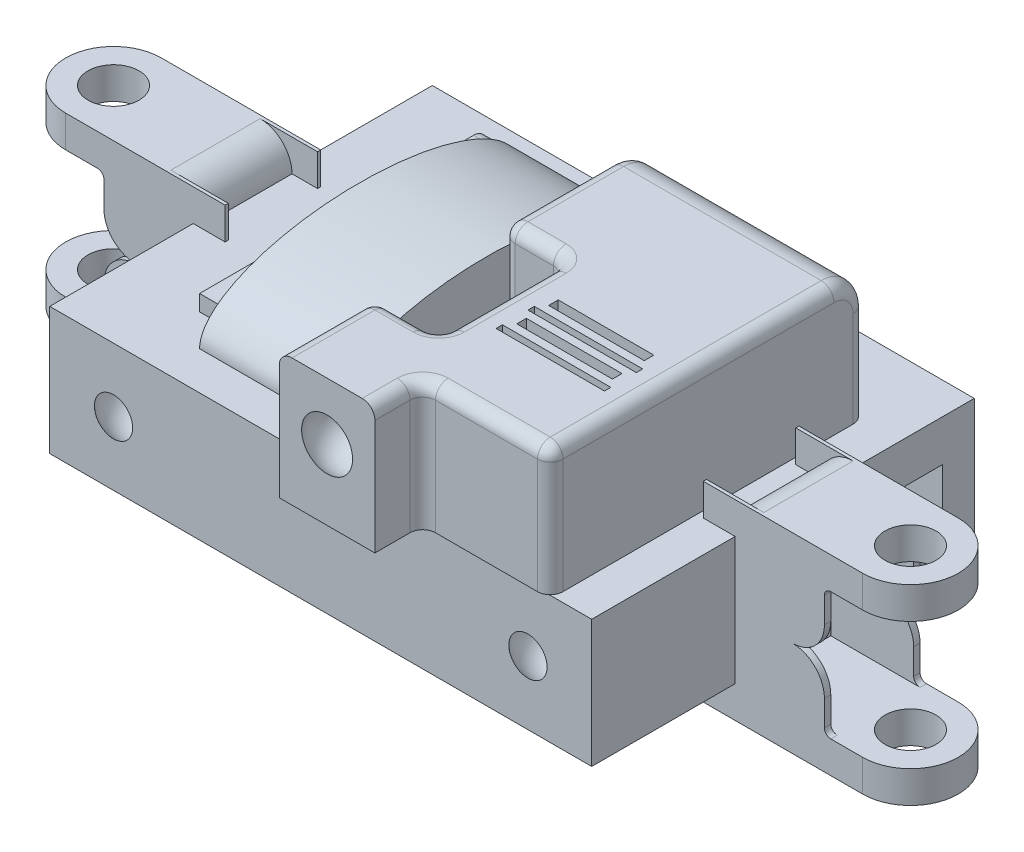
from build123d import *

# Parameters (mm, degrees)
SKETCH1_W                = 85
SKETCH1_H                = 60
BOSS_EXTRUDE1_DEPTH      = 20
BOSS_EXTRUDE4_DEPTH      = 5
SKETCH4_W                = 4
SKETCH4_H                = 14
CUT_EXTRUDE2_DEPTH       = 5
FILLET1_R                = 5
SKETCH5_W                = 14
SKETCH5_H                = 10
BOSS_EXTRUDE6_DEPTH      = 7.5
SKETCH7_W                = 12
SKETCH7_H                = 13
CUT_EXTRUDE5_DEPTH       = 10
SKETCH8_W                = 13
SKETCH8_H                = 10
CUT_EXTRUDE6_DEPTH       = 10
FILLET4_R                = 5
FILLET5_R                = 1
SKETCH9_R                = 4
CUT_EXTRUDE7_DEPTH       = 10
BOSS_EXTRUDE7_DEPTH      = 20
FILLET6_R                = 5
FILLET7_START            = 20
FILLET7_DEPTH            = 21
FILLET7_2_DEPTH          = 20
FILLET8_R                = 2
CIRPATTERN1_COUNT        = 2
FILLET1_OF_CIRPATTERN1_R = 5
FILLET4_OF_CIRPATTERN1_R = 5
FILLET5_OF_CIRPATTERN1_R = 1
CIRPATTERN5_START        = -7.5
CIRPATTERN5_DEPTH        = 1
CIRPATTERN5_START_2      = 6.5
CIRPATTERN5_2_DEPTH      = 1
CIRPATTERN5_START_3      = -5
CIRPATTERN5_3_OUTLINE_R  = 4
CIRPATTERN5_3_DEPTH      = 5
CIRPATTERN5_4_OUTLINE_W  = 1
CIRPATTERN5_4_OUTLINE_H  = 15
CIRPATTERN5_4_DEPTH      = 10
CIRPATTERN5_START_4      = -7
CIRPATTERN5_5_DEPTH      = 14
CIRPATTERN5_6_DEPTH      = 14
MIRROR1_START            = -7.5
MIRROR1_DEPTH            = 1
MIRROR1_START_2          = 6.5
MIRROR1_2_DEPTH          = 1
MIRROR1_START_3          = -5
MIRROR1_3_OUTLINE_R      = 4
MIRROR1_3_DEPTH          = 5
MIRROR1_4_OUTLINE_W      = 1
MIRROR1_4_OUTLINE_H      = 15
MIRROR1_4_DEPTH          = 10
MIRROR1_START_4          = -7
MIRROR1_5_DEPTH          = 14
MIRROR1_6_DEPTH          = 14
SKETCH16_W               = 17
SKETCH16_H               = 1
CUT_EXTRUDE9_DEPTH       = 5
BOSS_EXTRUDE8_DEPTH      = 20
BOSS_EXTRUDE9_DEPTH      = 5
SKETCH25_W               = 9
SKETCH25_H               = 7
CUT_EXTRUDE10_DEPTH      = 126.300638466
SKETCH11_W               = 15
SKETCH11_H               = 1.5
CUT_EXTRUDE8_DEPTH       = 20
SKETCH26_W               = 10
SKETCH26_H               = 9
CUT_EXTRUDE11_DEPTH      = 127.199247224


with BuildPart() as part:
    # Sketch1 → Boss-Extrude1 (new body)
    with BuildSketch(Plane(origin=(0, 0, 0), x_dir=(1, 0, 0), z_dir=(0, 1, 0))):
        Rectangle(SKETCH1_W, SKETCH1_H)
    extrude(amount=BOSS_EXTRUDE1_DEPTH)

    # Sketch2 → Boss-Extrude4 (add)
    with BuildSketch(Plane(origin=(0, 20, 0), x_dir=(1, 0, 0), z_dir=(0, 1, 0))):
        with BuildLine():
            Line((-37.5, 7.5), (-62.5, 7.5))
            ThreePointArc((-62.5, 7.5), (-70, 0), (-62.5, -7.5))
            Line((-62.5, -7.5), (-37.5, -7.5))
            Line((-37.5, -7.5), (-37.5, 7.5))
        make_face()
    boss_extrude4 = extrude(amount=BOSS_EXTRUDE4_DEPTH)

    # Sketch4 → Cut-Extrude2 (cut)
    with BuildSketch(Plane(origin=(0, 25, 0), x_dir=(1, 0, 0), z_dir=(0, 1, 0))):
        with Locations((-39.5, 0)):
            Rectangle(SKETCH4_W, SKETCH4_H)
    cut_extrude2 = extrude(amount=-CUT_EXTRUDE2_DEPTH, mode=Mode.SUBTRACT)

    # Fillet1
    fillet1_edges = [part.edges().sort_by_distance(p)[0] for p in [
        (-41.5, 25, 0),
    ]]
    fillet(fillet1_edges, radius=FILLET1_R - 0.0001)  # a hair under: the kernel refuses the full size

    # Sketch5 → Boss-Extrude6 (add, symmetric)
    with BuildSketch(Plane.XY):
        with Locations((-49.5, 15)):
            Rectangle(SKETCH5_W, SKETCH5_H)
    boss_extrude6 = extrude(amount=BOSS_EXTRUDE6_DEPTH, both=True)

    # Sketch7 → Cut-Extrude5 (cut)
    with BuildSketch(Plane.XZ.offset(-10)):
        with Locations((-49.5, 0)):
            Rectangle(SKETCH7_W, SKETCH7_H)
    cut_extrude5 = extrude(amount=-CUT_EXTRUDE5_DEPTH, mode=Mode.SUBTRACT)

    # Sketch8 → Cut-Extrude6 (cut)
    with BuildSketch(Plane(origin=(-55.5, 0, 0), x_dir=(0, 0, -1), z_dir=(1, 0, 0))):
        with Locations((0, 15)):
            Rectangle(SKETCH8_W, SKETCH8_H)
    cut_extrude6 = extrude(amount=-CUT_EXTRUDE6_DEPTH, mode=Mode.SUBTRACT)

    # Fillet4
    fillet4_edges = [part.edges().sort_by_distance(p)[0] for p in [
        (-56.5, 10, -7),
        (-56.5, 10, 7),
    ]]
    fillet(fillet4_edges, radius=FILLET4_R)

    # Fillet5
    fillet5_edges = [part.edges().sort_by_distance(p)[0] for p in [
        (-56.5, 20, -7),
        (-56.5, 20, 7),
    ]]
    fillet(fillet5_edges, radius=FILLET5_R)

    # Sketch9 → Cut-Extrude7 (cut)
    with BuildSketch(Plane(origin=(0, 25, 0), x_dir=(1, 0, 0), z_dir=(0, 1, 0))):
        with Locations(Location((-62.5, 0, 0), (0, 0, 270))):
            Circle(SKETCH9_R)
    cut_extrude7 = extrude(amount=-CUT_EXTRUDE7_DEPTH, mode=Mode.SUBTRACT)

    # Sketch10 → Boss-Extrude7 (add)
    with BuildSketch(Plane(origin=(0, 20, 0), x_dir=(1, 0, 0), z_dir=(0, 1, 0))):
        Polygon((1.5, -3), (11.5, -3), (11.5, -23), (1.5, -23), (1.5, -38), (16.5, -38), (16.5, -30.5), (36.5, -30.5), (36.5, 0.746164075), (36.5, 19), (1.5, 19), align=None)
    extrude(amount=BOSS_EXTRUDE7_DEPTH)

    # Fillet6
    fillet6_edges = [part.edges().sort_by_distance(p)[0] for p in [
        (19, 40, -19),
    ]]
    fillet(fillet6_edges, radius=FILLET6_R)

    # Fillet7: read off the stored shape, not the designer's step
    # Fillet7 outline → Fillet7 (cut)
    with BuildSketch(Plane(origin=(0, 0, 0), x_dir=(1, 0, 0), z_dir=(0, 1, 0)).offset(FILLET7_START)):
        with BuildLine():
            Line((36.5, -30.5), (36.5, -28.5))
            ThreePointArc((36.5, -28.5), (35.914213562, -29.914213562), (34.5, -30.5))
            Line((34.5, -30.5), (36.5, -30.5))
        make_face()
        with BuildLine():
            Line((1.5, -23), (1.5, -25))
            ThreePointArc((1.5, -25), (2.085786438, -23.585786438), (3.5, -23))
            Line((3.5, -23), (1.5, -23))
        make_face()
        with BuildLine():
            Line((1.5, -3), (3.5, -3))
            ThreePointArc((3.5, -3), (2.085786438, -2.414213562), (1.5, -1))
            Line((1.5, -1), (1.5, -3))
        make_face()
    extrude(amount=FILLET7_DEPTH, mode=Mode.SUBTRACT)

    # Fillet7 2 outline → Fillet7 2 (add)
    with BuildSketch(Plane(origin=(0, 0, 0), x_dir=(1, 0, 0), z_dir=(0, 1, 0)).offset(FILLET7_START)):
        with BuildLine():
            ThreePointArc((16.5, -32.5), (17.085786438, -31.085786438), (18.5, -30.5))
            Line((18.5, -30.5), (16.5, -30.5))
            Line((16.5, -30.5), (16.5, -32.5))
        make_face()
        with BuildLine():
            ThreePointArc((9.5, -3), (10.914213562, -3.585786438), (11.5, -5))
            Line((11.5, -5), (11.5, -3))
            Line((11.5, -3), (9.5, -3))
        make_face()
        with BuildLine():
            ThreePointArc((11.5, -21), (10.914213562, -22.414213562), (9.5, -23))
            Line((9.5, -23), (11.5, -23))
            Line((11.5, -23), (11.5, -21))
        make_face()
    extrude(amount=FILLET7_2_DEPTH)

    # Fillet8
    fillet8_edges = [part.edges().sort_by_distance(p)[0] for p in [
        (16.5, 40, 35.25),
        (1.5, 40, -6.5),
        (1.5, 27.5, -19),
        (1.5, 38.535533906, -17.535533906),
        (36.5, 27.5, -19),
        (36.5, 38.535533906, -17.535533906),
        (36.5, 40, 7.25),
        (26.5, 40, 30.5),
        (6.5, 40, 3),
        (11.5, 40, 13),
        (6.5, 40, 23),
        (1.5, 40, 31.5),
        (2.085786438, 40, 2.414213562),
        (2.085786438, 40, 23.585786438),
        (35.914213562, 40, 29.914213562),
        (17.085786438, 40, 31.085786438),
        (10.914213562, 40, 22.414213562),
        (10.914213562, 40, 3.585786438),
    ]]
    fillet(fillet8_edges, radius=FILLET8_R)

    # CirPattern1: Boss-Extrude4, Cut-Extrude2, Boss-Extrude6, Cut-Extrude5, Cut-Extrude6, Cut-Extrude7 ×2 about axis
    cirpattern1_axis = Axis((0, 0, 0), (0, 1, 0))
    add([boss_extrude4.rotate(cirpattern1_axis, i * 360 / CIRPATTERN1_COUNT) for i in range(1, CIRPATTERN1_COUNT)])
    add([cut_extrude2.rotate(cirpattern1_axis, i * 360 / CIRPATTERN1_COUNT) for i in range(1, CIRPATTERN1_COUNT)], mode=Mode.SUBTRACT)
    add([boss_extrude6.rotate(cirpattern1_axis, i * 360 / CIRPATTERN1_COUNT) for i in range(1, CIRPATTERN1_COUNT)])
    add([cut_extrude5.rotate(cirpattern1_axis, i * 360 / CIRPATTERN1_COUNT) for i in range(1, CIRPATTERN1_COUNT)], mode=Mode.SUBTRACT)
    add([cut_extrude6.rotate(cirpattern1_axis, i * 360 / CIRPATTERN1_COUNT) for i in range(1, CIRPATTERN1_COUNT)], mode=Mode.SUBTRACT)
    add([cut_extrude7.rotate(cirpattern1_axis, i * 360 / CIRPATTERN1_COUNT) for i in range(1, CIRPATTERN1_COUNT)], mode=Mode.SUBTRACT)

    # Fillet1 of CirPattern1
    fillet1_of_cirpattern1_edges = [part.edges().sort_by_distance(p)[0] for p in [
        (41.5, 25, 0),
    ]]
    fillet(fillet1_of_cirpattern1_edges, radius=FILLET1_OF_CIRPATTERN1_R - 0.0001)  # a hair under: the kernel refuses the full size

    # Fillet4 of CirPattern1
    fillet4_of_cirpattern1_edges = [part.edges().sort_by_distance(p)[0] for p in [
        (56.5, 10, 7),
        (56.5, 10, -7),
    ]]
    fillet(fillet4_of_cirpattern1_edges, radius=FILLET4_OF_CIRPATTERN1_R)

    # Fillet5 of CirPattern1
    fillet5_of_cirpattern1_edges = [part.edges().sort_by_distance(p)[0] for p in [
        (56.5, 20, 7),
        (56.5, 20, -7),
    ]]
    fillet(fillet5_of_cirpattern1_edges, radius=FILLET5_OF_CIRPATTERN1_R)

    # CirPattern5: read off the stored shape, not the designer's step
    # CirPattern5 outline → CirPattern5 (add)
    with BuildSketch(Plane.XY.offset(CIRPATTERN5_START)):
        with BuildLine():
            ThreePointArc((57.5, 0), (56.792893219, 0.292893219), (56.5, 1))
            Line((56.5, 1), (56.5, 5))
            ThreePointArc((56.5, 5), (55.035533906, 8.535533906), (51.5, 10))
            Line((51.5, 10), (43.5, 10))
            Line((43.5, 10), (43.5, 0))
            Line((43.5, 0), (57.5, 0))
        make_face()
    extrude(amount=CIRPATTERN5_DEPTH)

    # CirPattern5 2 outline → CirPattern5 2 (add)
    with BuildSketch(Plane.XY.offset(CIRPATTERN5_START_2)):
        with BuildLine():
            ThreePointArc((57.5, 0), (56.792893219, 0.292893219), (56.5, 1))
            Line((56.5, 1), (56.5, 5))
            ThreePointArc((56.5, 5), (55.035533906, 8.535533906), (51.5, 10))
            Line((51.5, 10), (43.5, 10))
            Line((43.5, 10), (43.5, 0))
            Line((43.5, 0), (57.5, 0))
        make_face()
    extrude(amount=CIRPATTERN5_2_DEPTH)

    # CirPattern5 3 outline → CirPattern5 3 (add)
    with BuildSketch(Plane(origin=(0, 0, 0), x_dir=(1, 0, 0), z_dir=(0, 1, 0)).offset(CIRPATTERN5_START_3)):
        with BuildLine():
            Line((37.5, 7.5), (37.5, 7))
            Line((37.5, 7), (42.5, 7))
            Line((42.5, 7), (42.5, -7))
            Line((42.5, -7), (37.5, -7))
            Line((37.5, -7), (37.5, -7.5))
            Line((37.5, -7.5), (62.5, -7.5))
            ThreePointArc((62.5, -7.5), (70, 0), (62.5, 7.5))
            Line((62.5, 7.5), (37.5, 7.5))
        make_face()
        with Locations((62.5, 0)):
            Circle(CIRPATTERN5_3_OUTLINE_R, mode=Mode.SUBTRACT)
    extrude(amount=CIRPATTERN5_3_DEPTH)

    # CirPattern5 4 outline → CirPattern5 4 (add)
    with BuildSketch(Plane(origin=(0, 0, 0), x_dir=(1, 0, 0), z_dir=(0, 1, 0))):
        with Locations((43, 0)):
            Rectangle(CIRPATTERN5_4_OUTLINE_W, CIRPATTERN5_4_OUTLINE_H)
    extrude(amount=CIRPATTERN5_4_DEPTH)

    # CirPattern5 5 outline → CirPattern5 5 (cut)
    with BuildSketch(Plane.XY.offset(CIRPATTERN5_START_4)):
        with BuildLine():
            Line((42.5, -5), (46.5, -5))
            ThreePointArc((46.5, -5), (44.263932023, -4.472135955), (42.5, -3))
            Line((42.5, -3), (42.5, -5))
        make_face()
    extrude(amount=CIRPATTERN5_5_DEPTH, mode=Mode.SUBTRACT)

    # CirPattern5 6 outline → CirPattern5 6 (add)
    with BuildSketch(Plane.XY.offset(CIRPATTERN5_START_4)):
        with BuildLine():
            ThreePointArc((41.5, 0), (41.75658351, -1.58113883), (42.5, -3))
            Line((42.5, -3), (42.5, 0))
            Line((42.5, 0), (41.5, 0))
        make_face()
    extrude(amount=CIRPATTERN5_6_DEPTH)

    # Mirror1: read off the stored shape, not the designer's step
    # Mirror1 outline → Mirror1 (add)
    with BuildSketch(Plane.XY.offset(MIRROR1_START)):
        with BuildLine():
            Line((-56.5, 5), (-56.5, 1))
            ThreePointArc((-56.5, 1), (-56.792893219, 0.292893219), (-57.5, 0))
            Line((-57.5, 0), (-43.5, 0))
            Line((-43.5, 0), (-43.5, 10))
            Line((-43.5, 10), (-51.5, 10))
            ThreePointArc((-51.5, 10), (-55.035533906, 8.535533906), (-56.5, 5))
        make_face()
    extrude(amount=MIRROR1_DEPTH)

    # Mirror1 2 outline → Mirror1 2 (add)
    with BuildSketch(Plane.XY.offset(MIRROR1_START_2)):
        with BuildLine():
            Line((-56.5, 5), (-56.5, 1))
            ThreePointArc((-56.5, 1), (-56.792893219, 0.292893219), (-57.5, 0))
            Line((-57.5, 0), (-43.5, 0))
            Line((-43.5, 0), (-43.5, 10))
            Line((-43.5, 10), (-51.5, 10))
            ThreePointArc((-51.5, 10), (-55.035533906, 8.535533906), (-56.5, 5))
        make_face()
    extrude(amount=MIRROR1_2_DEPTH)

    # Mirror1 3 outline → Mirror1 3 (add)
    with BuildSketch(Plane(origin=(0, 0, 0), x_dir=(1, 0, 0), z_dir=(0, 1, 0)).offset(MIRROR1_START_3)):
        with BuildLine():
            Line((-37.5, -7.5), (-37.5, -7))
            Line((-37.5, -7), (-42.5, -7))
            Line((-42.5, -7), (-42.5, 7))
            Line((-42.5, 7), (-37.5, 7))
            Line((-37.5, 7), (-37.5, 7.5))
            Line((-37.5, 7.5), (-62.5, 7.5))
            ThreePointArc((-62.5, 7.5), (-70, 0), (-62.5, -7.5))
            Line((-62.5, -7.5), (-37.5, -7.5))
        make_face()
        with Locations((-62.5, 0)):
            Circle(MIRROR1_3_OUTLINE_R, mode=Mode.SUBTRACT)
    extrude(amount=MIRROR1_3_DEPTH)

    # Mirror1 4 outline → Mirror1 4 (add)
    with BuildSketch(Plane(origin=(0, 0, 0), x_dir=(1, 0, 0), z_dir=(0, 1, 0))):
        with Locations((-43, 0)):
            Rectangle(MIRROR1_4_OUTLINE_W, MIRROR1_4_OUTLINE_H)
    extrude(amount=MIRROR1_4_DEPTH)

    # Mirror1 5 outline → Mirror1 5 (cut)
    with BuildSketch(Plane.XY.offset(MIRROR1_START_4)):
        with BuildLine():
            ThreePointArc((-42.5, -3), (-44.263932023, -4.472135955), (-46.5, -5))
            Line((-46.5, -5), (-42.5, -5))
            Line((-42.5, -5), (-42.5, -3))
        make_face()
    extrude(amount=MIRROR1_5_DEPTH, mode=Mode.SUBTRACT)

    # Mirror1 6 outline → Mirror1 6 (add)
    with BuildSketch(Plane.XY.offset(MIRROR1_START_4)):
        with BuildLine():
            Line((-42.5, 0), (-42.5, -3))
            ThreePointArc((-42.5, -3), (-41.75658351, -1.58113883), (-41.5, 0))
            Line((-41.5, 0), (-42.5, 0))
        make_face()
    extrude(amount=MIRROR1_6_DEPTH)

    # Sketch16 → Cut-Extrude9 (cut)
    with BuildSketch(Plane(origin=(0, 40, 0), x_dir=(1, 0, 0), z_dir=(0, 1, 0))):
        with Locations((24, -12.5)):
            Rectangle(SKETCH16_W, SKETCH16_H)
        with Locations((24, -17.5)):
            Rectangle(SKETCH16_W, SKETCH16_H)
    extrude(amount=-CUT_EXTRUDE9_DEPTH, mode=Mode.SUBTRACT)

    # Sketch17 → Boss-Extrude8 (add)
    with BuildSketch(Plane(origin=(-5, 0, 0), x_dir=(0, 0, -1), z_dir=(1, 0, 0))):
        with BuildLine():
            Line((26, 20), (-24, 20))
            add(Edge.make_bspline(
                [(26, 20), (26, 30), (1, 30), (-24, 30), (-24, 20)],
                knots=[3.141592654, 3.141592654, 3.141592654, 4.71238898, 4.71238898, 6.283185307, 6.283185307, 6.283185307], degree=2, weights=[1, 0.707106781, 1, 0.707106781, 1]))
        make_face()
    extrude(amount=-BOSS_EXTRUDE8_DEPTH)

    # Sketch18 → Boss-Extrude9 (add)
    with BuildSketch(Plane.ZY.offset(25)):
        with BuildLine():
            Line((-24, 22.5), (19, 22.5))
            Line((19, 22.5), (19, 20))
            Line((19, 20), (-26, 20))
            Line((-26, 20), (-26, 20.5))
            ThreePointArc((-26, 20.5), (-25.414213562, 21.914213562), (-24, 22.5))
        make_face()
    extrude(amount=BOSS_EXTRUDE9_DEPTH)

    # Sketch19 → Cut-Revolve2 (revolve, cut)
    with BuildSketch(Plane.XY.offset(26)):
        with BuildLine():
            Line((-32.5, 15), (-32.5, 5))
            ThreePointArc((-32.5, 5), (-27.5, 10), (-32.5, 15))
        make_face()
    cut_revolve2 = revolve(axis=Axis((-32.5, 15, 26), (0, -1, 0)), mode=Mode.SUBTRACT)

    # Mirror3: Cut-Revolve2 across plane
    add(cut_revolve2.mirror(Plane(origin=(0, 0, 0), x_dir=(0, 0, 1), z_dir=(1, 0, 0))), mode=Mode.SUBTRACT)

    # Sketch25 → Cut-Extrude10 (cut, through all)
    with BuildSketch(Plane.ZY.offset(42.5)):
        with Locations((-20.5, 10)):
            Rectangle(SKETCH25_W, SKETCH25_H)
    extrude(amount=-CUT_EXTRUDE10_DEPTH, mode=Mode.SUBTRACT)

    # Sketch11 → Cut-Extrude8 (cut)
    with BuildSketch(Plane(origin=(0, 40, 0), x_dir=(1, 0, 0), z_dir=(0, 1, 0))):
        with Locations((24, -15)):
            Rectangle(SKETCH11_W, SKETCH11_H)
        with Locations((24, -10)):
            Rectangle(SKETCH11_W, SKETCH11_H)
    extrude(amount=-CUT_EXTRUDE8_DEPTH, mode=Mode.SUBTRACT)

    # Sketch26 → Cut-Extrude11 (cut, through all)
    with BuildSketch(Plane.ZY.offset(43.5)):
        with Locations((0, 8.5)):
            Rectangle(SKETCH26_W, SKETCH26_H)
    extrude(amount=-CUT_EXTRUDE11_DEPTH, mode=Mode.SUBTRACT)

    # Sketch29 → Cut-Revolve3 (revolve, cut)
    with BuildSketch(Plane.XY.offset(35)):
        with BuildLine():
            Line((9, 26), (9, 36))
            ThreePointArc((9, 36), (14, 31), (9, 26))
        make_face()
    revolve(axis=Axis((9, 36, 35), (0, -1, 0)), mode=Mode.SUBTRACT)


solid = part.part
